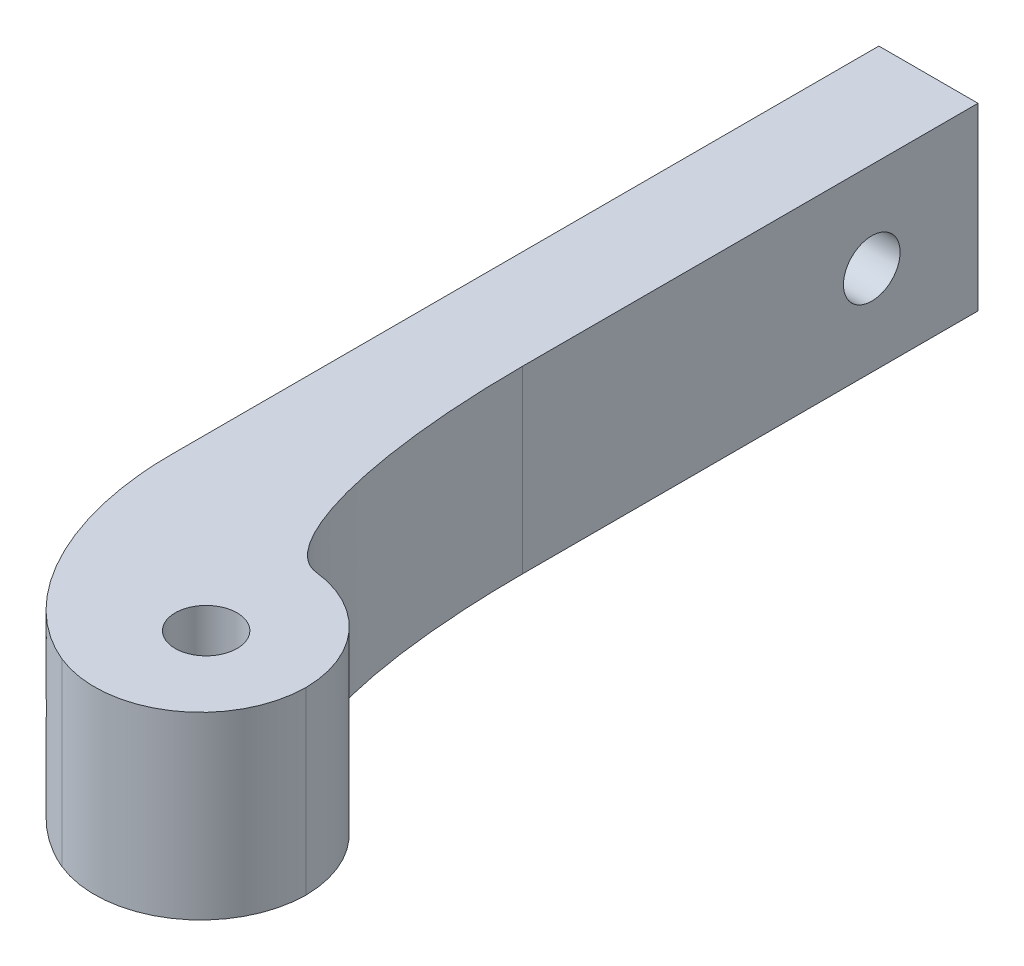
from build123d import *

# Parameters (mm, degrees)
SKETCH1_W               = 7
SKETCH1_H               = 52
BOSS_EXTRUDE1_DEPTH     = 12.7
SKETCH2_R               = 2
CUT_EXTRUDE1_DEPTH      = 10
SKETCH3_W               = 24
SKETCH3_H               = 15
BOSS_EXTRUDE2_DEPTH     = 12.7
CUT_EXTRUDE2_DEPTH      = 48.566164445
CUT_EXTRUDE2_DEPTH_BACK = 48.566164445
SKETCH4_R               = 2.1844
FILLET1_SIZE            = 17
FILLET1_SIZE_2          = 12
CUT_EXTRUDE3_DEPTH      = 48.566164601
CUT_EXTRUDE3_DEPTH_BACK = 48.566164601
SKETCH5_W               = 5
SKETCH5_H               = 15
FILLET2_R               = 7.5
FILLET3_DEPTH           = 12.7


with BuildPart() as part:
    # Sketch1 → Boss-Extrude1 (new body)
    with BuildSketch(Plane(origin=(0, 0, 0), x_dir=(1, 0, 0), z_dir=(0, 1, 0))):
        Rectangle(SKETCH1_W, SKETCH1_H)
    extrude(amount=BOSS_EXTRUDE1_DEPTH)

    # Sketch2 → Cut-Extrude1 (cut)
    with BuildSketch(Plane.ZY.offset(3.5)):
        with Locations((-18.5, 6.35)):
            Circle(SKETCH2_R)
    extrude(amount=-CUT_EXTRUDE1_DEPTH, mode=Mode.SUBTRACT)

    # Sketch3 → Boss-Extrude2 (add)
    with BuildSketch(Plane.XZ):
        with Locations((8.5, 33.5)):
            Rectangle(SKETCH3_W, SKETCH3_H)
    extrude(amount=-BOSS_EXTRUDE2_DEPTH)

    # Sketch4 → Cut-Extrude2 (cut, two sides: drawn at the far end of the back side and taken through both)
    with BuildSketch(Plane(origin=(0, 12.7, 0), x_dir=(1, 0, 0), z_dir=(0, 1, 0)).offset(-CUT_EXTRUDE2_DEPTH_BACK)):
        with Locations(Location((8.5, -33.5, 0), (0, 0, 270))):
            Circle(SKETCH4_R)
    extrude(amount=CUT_EXTRUDE2_DEPTH + CUT_EXTRUDE2_DEPTH_BACK, mode=Mode.SUBTRACT)

    # Fillet1
    # a fillet whose section is not a circle: 17, 12 mm, written as the material it takes off along each edge
    with BuildSketch(Plane(origin=(-3.5, -42.5, 41), x_dir=(0, 0, -1), z_dir=(0, 1, 0))) as fillet1_piece_1:
        with BuildLine():
            Bezier((FILLET1_SIZE, 0), (0, 0), (0, -FILLET1_SIZE_2), weights=[1, 0.707106781, 1])
            Line((0, -FILLET1_SIZE_2), (0, 0))
            Line((0, 0), (FILLET1_SIZE, 0))
        make_face()
    extrude(amount=97.7, mode=Mode.SUBTRACT)

    # Sketch5 → Cut-Extrude3 (cut, two sides: drawn at the far end of the back side and taken through both)
    with BuildSketch(Plane(origin=(0, 12.7, 0), x_dir=(1, 0, 0), z_dir=(0, 1, 0)).offset(-CUT_EXTRUDE3_DEPTH_BACK)):
        with Locations((18, -33.5)):
            Rectangle(SKETCH5_W, SKETCH5_H)
    extrude(amount=CUT_EXTRUDE3_DEPTH + CUT_EXTRUDE3_DEPTH_BACK, mode=Mode.SUBTRACT)

    # Fillet2
    # the kernel refuses this fillet: 7.5 mm, written as the material it takes off along each edge
    with BuildSketch(Plane(origin=(15.5, -18.75, 26), x_dir=(-1, 0, 0), z_dir=(0, 1, 0))) as fillet2_piece_1:
        with BuildLine():
            CenterArc((FILLET2_R, FILLET2_R), FILLET2_R, 180, 90)
            Line((0, FILLET2_R), (0, 0))
            Line((0, 0), (FILLET2_R, 0))
        make_face()
    extrude(amount=50.2, mode=Mode.SUBTRACT)
    with BuildSketch(Plane(origin=(15.5, -26.005596716, 41), x_dir=(-0.9978099648287924, 0, -0.06614585465744831), z_dir=(0, 1, 0))) as fillet2_piece_2:
        with BuildLine():
            CenterArc((7.98716223, -7.10052151), FILLET2_R, 71.215463445, 112.577183941)
            Line((0.503587494, -7.59661542), (-0.24476998, -7.646224811))
            Line((-0.24476998, -7.646224811), (-0.748357474, -0.049609391))
            Line((-0.748357474, -0.049609391), (-0.049609391, 0.748357474))
            ThreePointArc((-0.049609391, 0.748357474), (6.935060363, 1.211378456), (10.643746332, 0.710052151))
            Line((10.643746332, 0.710052151), (10.402238686, 0))
        make_face()
    extrude(amount=64.711193432, mode=Mode.SUBTRACT)

    # Fillet3: read off the stored shape, not the designer's step
    # Fillet3 outline → Fillet3 (add)
    with BuildSketch(Plane(origin=(0, 0, 0), x_dir=(1, 0, 0), z_dir=(0, 1, 0))):
        with BuildLine():
            add(Edge.make_bspline(
                [(3.5, -6.164126134), (3.5, -25.461113038), (8.818181818, -26.044761673)],
                knots=[0, 0, 0, 1, 1, 1], degree=2, weights=[1, 0.744678088, 1]))
            Line((3.5, -6.164126134), (3.5, -26))
            Line((3.5, -26), (8, -26))
            ThreePointArc((8, -26), (8.409702665, -26.011198779), (8.818181818, -26.044761673))
        make_face()
    extrude(amount=FILLET3_DEPTH)


solid = part.part
